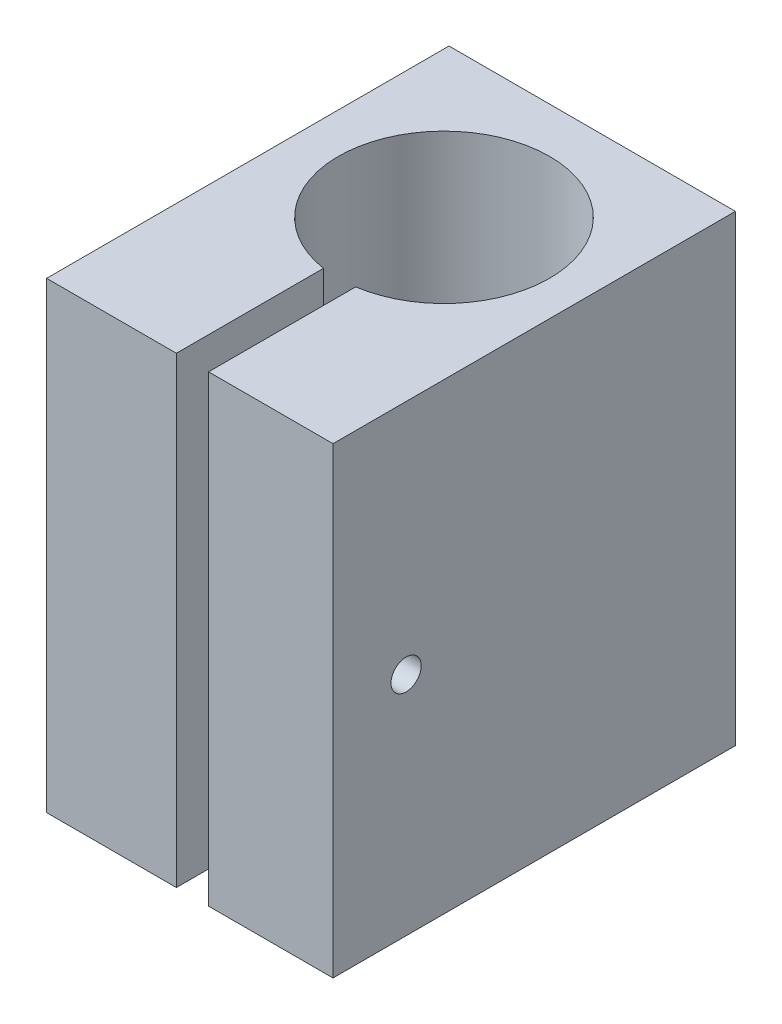
from build123d import *

# Parameters (mm, degrees)
EXTRUDE_1_DEPTH     = 46
CUT_EXTRUDE_1_DEPTH = 3
SKETCH_3_R          = 1.5
CUT_EXTRUDE_2_DEPTH = 57.25585214


with BuildPart() as part:
    # Эскиз1 → Бобышка-Вытянуть1 (new body)
    with BuildSketch(Plane(origin=(0, 0, 0), x_dir=(1, 0, 0), z_dir=(0, 1, 0))):
        with BuildLine():
            Line((-14.235, 20), (14.235, 20))
            Line((14.235, 20), (14.235, -20))
            Line((14.235, -20), (1.865, -20))
            Line((1.865, -20), (1.865, -5.377379245))
            ThreePointArc((1.865, -5.377379245), (0.265, 15.5), (-1.335, -5.377379245))
            Line((-1.335, -5.377379245), (-1.335, -20))
            Line((-1.335, -20), (-14.235, -20))
            Line((-14.235, -20), (-14.235, 20))
        make_face()
    extrude(amount=EXTRUDE_1_DEPTH)

    # Эскиз2 → Вырез-Вытянуть1 (cut)
    with BuildSketch(Plane.ZY.offset(14.235)):
        Polygon((15.723556431, 21.181579647), (15.803083153, 24.68067603), (12.812540156, 26.499096383), (9.742470437, 24.818420353), (9.662943715, 21.31932397), (12.653486712, 19.500903617), align=None)
    extrude(amount=-CUT_EXTRUDE_1_DEPTH, mode=Mode.SUBTRACT)

    # Эскиз3 → Вырез-Вытянуть2 (cut, through all)
    with BuildSketch(Plane.ZY.offset(11.235)):
        with Locations((12.733013434, 22.5)):
            Circle(SKETCH_3_R)
    extrude(amount=-CUT_EXTRUDE_2_DEPTH, mode=Mode.SUBTRACT)


solid = part.part
